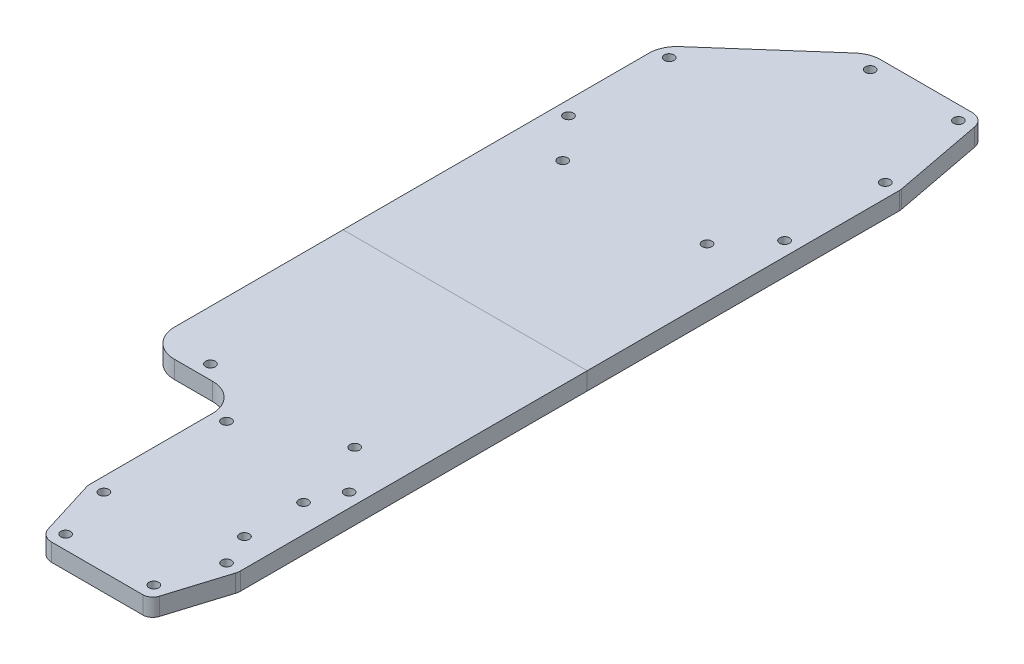
from build123d import *

# Parameters (mm, degrees)
SKETCH1_R           = 1.75
BOSS_EXTRUDE1_DEPTH = 6.35
FILLET1_R           = 10


with BuildPart() as part:
    # Sketch1 → Boss-Extrude1 (new body)
    with BuildSketch(Plane(origin=(0, 0, 0), x_dir=(1, 0, 0), z_dir=(0, 1, 0))):
        with BuildLine():
            ThreePointArc((40.224213369, 3.519506144), (42.033728711, 0.974924269), (45, 0))
            Line((45, 0), (77.838194951, 0))
            ThreePointArc((77.838194951, 0), (79.96870358, 0.700234188), (81.268378382, 2.527866631))
            Line((81.268378382, 2.527866631), (87.775786631, 23.519506144))
            ThreePointArc((87.775786631, 23.519506144), (87.943628887, 24.251312199), (88, 25))
            Line((88, 25), (88, 262.5))
            ThreePointArc((88, 262.5), (87.977579487, 262.975336195), (87.91051703, 263.446451684))
            Line((87.91051703, 263.446451684), (81.711403, 295.937080875))
            ThreePointArc((81.711403, 295.937080875), (79.987051586, 298.852622768), (76.8, 300))
            Line((76.8, 300), (40, 300))
            Line((40, 300), (0, 264.782169894))
            Line((0, 264.782169894), (0, 79.2))
            Line((0, 79.2), (33.8, 79.2))
            Line((33.8, 79.2), (33.8, 25))
            ThreePointArc((33.8, 25), (33.856371113, 24.251312199), (34.024213369, 23.519506144))
            Line((34.024213369, 23.519506144), (40.224213369, 3.519506144))
        make_face()
        with Locations((38.8, 25)):
            Circle(SKETCH1_R, mode=Mode.SUBTRACT)
        with Locations((38.8, 69.2)):
            Circle(SKETCH1_R, mode=Mode.SUBTRACT)
        with Locations((18, 84.2)):
            Circle(SKETCH1_R, mode=Mode.SUBTRACT)
        with Locations((45, 5)):
            Circle(SKETCH1_R, mode=Mode.SUBTRACT)
        with Locations((76.8, 5)):
            Circle(SKETCH1_R, mode=Mode.SUBTRACT)
        with Locations((78, 36.45)):
            Circle(SKETCH1_R, mode=Mode.SUBTRACT)
        with Locations((83, 25)):
            Circle(SKETCH1_R, mode=Mode.SUBTRACT)
        with Locations((78, 57.75)):
            Circle(SKETCH1_R, mode=Mode.SUBTRACT)
        with Locations((83, 69.2)):
            Circle(SKETCH1_R, mode=Mode.SUBTRACT)
        with Locations((70, 84.2)):
            Circle(SKETCH1_R, mode=Mode.SUBTRACT)
        with Locations((18, 211.2)):
            Circle(SKETCH1_R, mode=Mode.SUBTRACT)
        with Locations((5.05, 226.2)):
            Circle(SKETCH1_R, mode=Mode.SUBTRACT)
        with Locations((5.05, 262.5)):
            Circle(SKETCH1_R, mode=Mode.SUBTRACT)
        with Locations((70, 211.2)):
            Circle(SKETCH1_R, mode=Mode.SUBTRACT)
        with Locations((45, 295)):
            Circle(SKETCH1_R, mode=Mode.SUBTRACT)
        with Locations((82.95, 226.2)):
            Circle(SKETCH1_R, mode=Mode.SUBTRACT)
        with Locations((76.8, 295)):
            Circle(SKETCH1_R, mode=Mode.SUBTRACT)
        with Locations((82.95, 262.5)):
            Circle(SKETCH1_R, mode=Mode.SUBTRACT)
    extrude(amount=BOSS_EXTRUDE1_DEPTH)

    # Fillet1
    fillet1_edges = [part.edges().sort_by_distance(p)[0] for p in [
        (40, 3.175, -300),
        (0, 3.175, -264.782169894),
        (0, 3.175, -79.2),
        (33.8, 3.175, -79.2),
    ]]
    fillet(fillet1_edges, radius=FILLET1_R)


with BuildPart() as body_2:
    # Split1: the piece on the far side of the plane
    add(part.part)
    split(bisect_by=Plane.XY.offset(-150), keep=Keep.BOTTOM)


with BuildPart() as part_1:
    add(part.part)

    # Split1
    split(bisect_by=Plane.XY.offset(-150), keep=Keep.TOP)


solid = Compound([body_2.part, part_1.part])
